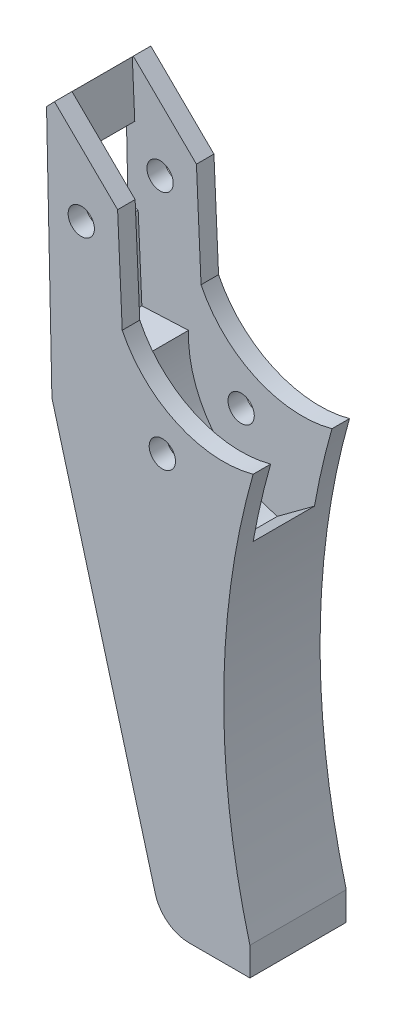
from build123d import *

# Parameters (mm, degrees)
SKETCH2_R           = 1.905
BOSS_EXTRUDE1_DEPTH = 13.97
SKETCH7_W           = 8.89
SKETCH7_H           = 13.736668288
CUT_EXTRUDE1_DEPTH  = 8.89
SKETCH8_W           = 15.99010018
SKETCH8_H           = 8.89
CUT_EXTRUDE2_DEPTH  = 38.354
CUT_EXTRUDE4_START  = -2.54
CUT_EXTRUDE4_DEPTH  = 8.89
FILLET1_R           = 5.08
CHAMFER1_SIZE       = 2.38
CHAMFER1_SIZE_2     = 1.683044883
CUT_EXTRUDE5_DEPTH  = 8.89


with BuildPart() as part:
    # Sketch2 → Boss-Extrude1 (new body)
    with BuildSketch(Plane.XY):
        with BuildLine():
            Line((-63.967060474, -130.859635454), (-76.667060474, -130.859635454))
            Line((-76.667060474, -130.859635454), (-92.67813479, -72.364175631))
            Line((-92.67813479, -72.364175631), (-93.509383851, -33.790725064))
            Line((-93.509383851, -33.790725064), (-83.152945307, -43.960741607))
            Line((-83.152945307, -43.960741607), (-82.481678491, -58.768900565))
            ThreePointArc((-82.481678491, -58.768900565), (-74.536997263, -66.480585097), (-63.5, -67.359635454))
            ThreePointArc((-63.5, -67.359635454), (-67.758675084, -97.020798424), (-63.967060474, -126.745275894))
            Line((-63.967060474, -126.745275894), (-63.967060474, -130.859635454))
        make_face()
        with Locations((-88.424072453, -48.053785371)):
            Circle(SKETCH2_R, mode=Mode.SUBTRACT)
        with Locations((-76.667060474, -71.37070905)):
            Circle(SKETCH2_R, mode=Mode.SUBTRACT)
    extrude(amount=-BOSS_EXTRUDE1_DEPTH)

    # Sketch7 → Cut-Extrude1 (cut)
    with BuildSketch(Plane(origin=(-84.97111807, -3.851815205, 0), x_dir=(0, 0, -1), z_dir=(0.9989741366022207, 0.04528437257871392, 0))):
        with Locations((6.985, -54.652422544)):
            Rectangle(SKETCH7_W, SKETCH7_H)
    extrude(amount=-CUT_EXTRUDE1_DEPTH, mode=Mode.SUBTRACT)

    # Sketch8 → Cut-Extrude2 (cut)
    with BuildSketch(Plane(origin=(2.163872462, -47.735068453, 0), x_dir=(0.9989741366022207, 0.04528437257871392, 0), z_dir=(0.04528437257871392, -0.9989741366022207, 0))):
        with Locations((-85.953326255, -6.985)):
            Rectangle(SKETCH8_W, SKETCH8_H)
    extrude(amount=-CUT_EXTRUDE2_DEPTH, mode=Mode.SUBTRACT)

    # Sketch9 → Cut-Extrude4 (cut)
    with BuildSketch(Plane.XY.offset(CUT_EXTRUDE4_START)):
        with BuildLine():
            Line((-82.481678491, -58.768900565), (-84.301115942, -65.397976437))
            ThreePointArc((-84.301115942, -65.397976437), (-80.869859076, -76.151152323), (-71.419742843, -82.323641162))
            Line((-71.419742843, -82.323641162), (-53.044010763, -68.759286996))
            Line((-53.044010763, -68.759286996), (-82.481678491, -58.768900565))
        make_face()
    extrude(amount=-CUT_EXTRUDE4_DEPTH, mode=Mode.SUBTRACT)

    # Fillet1
    fillet1_edges = [part.edges().sort_by_distance(p)[0] for p in [
        (-76.667060474, -130.859635454, -6.985),
    ]]
    fillet(fillet1_edges, radius=FILLET1_R)

    # Chamfer1
    # the kernel refuses this chamfer: 2.38, 1.683044883 mm, written as the material it takes off along each edge
    with BuildSketch(Plane(origin=(-93.509383851, -33.790725064, 6.120605511), x_dir=(-0.005952870242771505, -0.9999822815109639, 0), z_dir=(0, 0, -1))) as chamfer1_piece_1:
        Polygon((CHAMFER1_SIZE * 0.999621916911, -CHAMFER1_SIZE * 0.0274958766106), (CHAMFER1_SIZE_2 * 0.69639613284, -CHAMFER1_SIZE_2 * 0.717657596567), (0, 0), align=None)
    extrude(amount=26.211211023, mode=Mode.SUBTRACT)

    # Sketch10 → Cut-Extrude5 (cut)
    with BuildSketch(Plane.XY.offset(-11.43)):
        with BuildLine():
            add(Edge.make_bspline(
                [(-91.586396319, -42.98933193), (-93.184858066, -42.868299271), (-96.695097172, -48.735009259), (-91.017537843, -56.721704987), (-87.675016869, -48.216390701), (-90.229073725, -43.092105964), (-91.586396319, -42.98933193)],
                knots=[0, 0, 0, 0, 0.267383985, 0.513635097, 0.772952762, 1, 1, 1, 1], degree=3))
        make_face()
    extrude(amount=CUT_EXTRUDE5_DEPTH, mode=Mode.SUBTRACT)


solid = part.part
